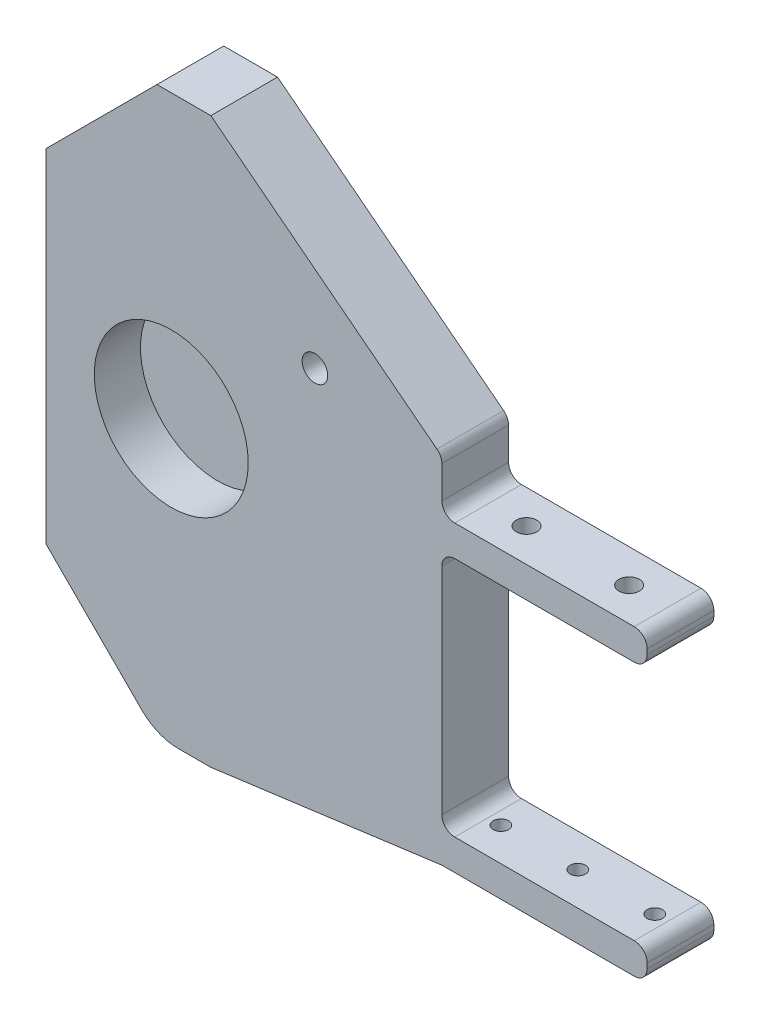
from build123d import *

# Parameters (mm, degrees)
RESSALTO_EXTRUS_O1_DEPTH = 6.5
ESBO_O2_R                = 15
CORTE_EXTRUS_O1_DEPTH    = 9
ESBO_O3_R                = 2.5
CORTE_EXTRUS_O2_DEPTH    = 13
FILETE1_R                = 10
ESBO_O4_R                = 2
CORTE_EXTRUS_O3_DEPTH    = 10
ESBO_O6_R                = 2
CORTE_EXTRUS_O4_DEPTH    = 10
ESBO_O7_R                = 1.5
CORTE_EXTRUS_O5_DEPTH    = 10
FILETE2_R                = 2.5


with BuildPart() as part:
    # Esboço1 → Ressalto-extrusão1 (new, symmetric)
    with BuildSketch(Plane.XY):
        Polygon((32.742040246, 55), (4.980147158, 55), (-22.781745931, 55), (-44.375431078, 33.406314852), (-44.375431078, -33.406314852), (-22.781745931, -55), (32.742040246, -55), (32.742040246, -49), (72.742040246, -49), (72.742040246, -43), (32.742040246, -43), (32.742040246, 4), (72.742040246, 4), (72.742040246, 10), (32.742040246, 10), align=None)
    extrude(amount=RESSALTO_EXTRUS_O1_DEPTH, both=True)

    # Esboço2 → Corte-extrusão1 (cut)
    with BuildSketch(Plane.XY.offset(6.5)):
        with Locations((-20, 0)):
            Circle(ESBO_O2_R)
    extrude(amount=-CORTE_EXTRUS_O1_DEPTH, mode=Mode.SUBTRACT)

    # Esboço3 → Corte-extrusão2 (cut)
    with BuildSketch(Plane.XY.offset(6.5)):
        with Locations((8, 22.5)):
            Circle(ESBO_O3_R)
        Polygon((-12.281745931, -55), (32.742040246, -49), (32.742040246, -55), align=None)
        Polygon((32.742040246, 55), (-12.281745931, 55), (32.742040246, 20), align=None)
    extrude(amount=-CORTE_EXTRUS_O2_DEPTH, mode=Mode.SUBTRACT)

    # Filete1
    filete1_edges = [part.edges().sort_by_distance(p)[0] for p in [
        (-22.781745931, -55, 0),
    ]]
    fillet(filete1_edges, radius=FILETE1_R)

    # Esboço4 → Corte-extrusão3 (cut)
    with BuildSketch(Plane(origin=(0, 0, -6.5), x_dir=(-1, 0, 0), z_dir=(0, 0, -1))):
        with Locations((36.375431078, 8.406314852)):
            Circle(ESBO_O4_R)
        with Locations((12.955431078, -16.593685148)):
            Circle(ESBO_O4_R)
        with Locations((22.375431078, -27.593685148)):
            Circle(ESBO_O4_R)
    extrude(amount=-CORTE_EXTRUS_O3_DEPTH, mode=Mode.SUBTRACT)

    # Esboço6 → Corte-extrusão4 (cut)
    with BuildSketch(Plane(origin=(0, 10, 0), x_dir=(1, 0, 0), z_dir=(0, 1, 0))):
        with Locations((42.742040246, -0.001621735)):
            Circle(ESBO_O6_R)
        with Locations((62.742040246, -0.001621735)):
            Circle(ESBO_O6_R)
    extrude(amount=-CORTE_EXTRUS_O4_DEPTH, mode=Mode.SUBTRACT)

    # Esboço7 → Corte-extrusão5 (cut)
    with BuildSketch(Plane.XZ.offset(49)):
        with Locations((37.742040246, 0)):
            Circle(ESBO_O7_R)
        with Locations((52.742040246, 0)):
            Circle(ESBO_O7_R)
        with Locations((67.742040246, 0)):
            Circle(ESBO_O7_R)
    extrude(amount=-CORTE_EXTRUS_O5_DEPTH, mode=Mode.SUBTRACT)

    # Filete2
    filete2_edges = [part.edges().sort_by_distance(p)[0] for p in [
        (72.742040246, -49, 0),
        (72.742040246, -43, 0),
        (72.742040246, 4, 0),
        (72.742040246, 10, 0),
        (32.742040246, 20, 0),
        (32.742040246, -43, 0),
        (32.742040246, 10, 0),
        (32.742040246, 4, 0),
    ]]
    fillet(filete2_edges, radius=FILETE2_R)


solid = part.part
